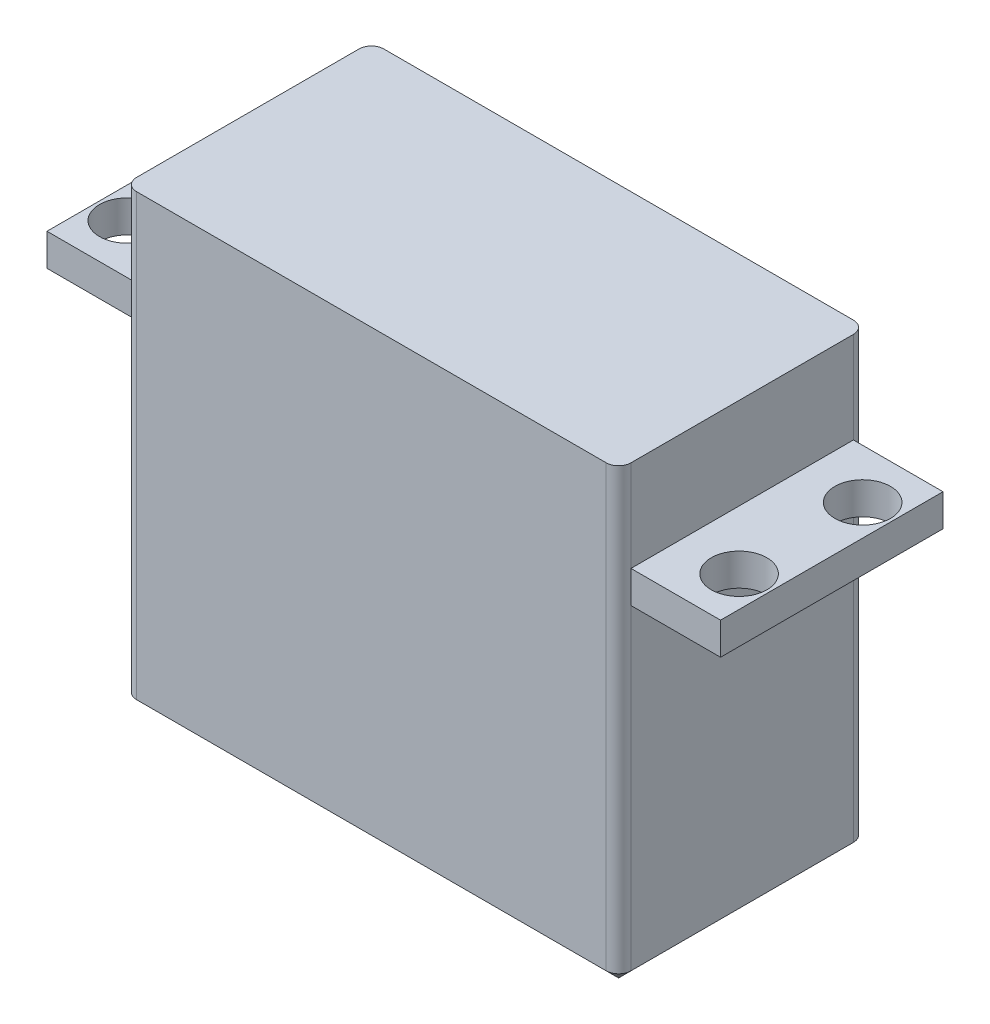
from build123d import *

# Parameters (mm, degrees)
SKETCH1_W               = 40
SKETCH1_H               = 20
BOSS_EXTRUDE1_DEPTH     = 36.6
SKETCH2_W               = 18
SKETCH2_H               = 2.6
BOSS_EXTRUDE2_DEPTH     = 7.25
SKETCH3_R               = 2.25
CUT_EXTRUDE1_DEPTH      = 42.17283692
MIRROR3_COPY_1_SKETCH_R = 2.25
MIRROR3_COPY_1_DEPTH    = 42.17283692
FILLET1_R               = 1
CHAMFER1_SIZE           = 1


with BuildPart() as part:
    # Sketch1 → Boss-Extrude1 (new body)
    with BuildSketch(Plane(origin=(0, 0, 0), x_dir=(1, 0, 0), z_dir=(0, 1, 0))):
        Rectangle(SKETCH1_W, SKETCH1_H)
    extrude(amount=BOSS_EXTRUDE1_DEPTH)

    # Sketch2 → Boss-Extrude2 (add)
    with BuildSketch(Plane(origin=(20, 0, 0), x_dir=(0, 0, -1), z_dir=(1, 0, 0))):
        with Locations((0, 27.9)):
            Rectangle(SKETCH2_W, SKETCH2_H)
    boss_extrude2 = extrude(amount=BOSS_EXTRUDE2_DEPTH)

    # Sketch3 → Cut-Extrude1 (cut, through all)
    with BuildSketch(Plane(origin=(0, 29.2, 0), x_dir=(1, 0, 0), z_dir=(0, 1, 0))):
        with Locations(Location((24.75, 5, 0), (0, 0, 270))):
            Circle(SKETCH3_R)
    cut_extrude1 = extrude(amount=-CUT_EXTRUDE1_DEPTH, mode=Mode.SUBTRACT)

    # Mirror2: Cut-Extrude1 across plane
    add(cut_extrude1.mirror(Plane.XY), mode=Mode.SUBTRACT)

    # Mirror3: Boss-Extrude2, Cut-Extrude1 across plane
    add(boss_extrude2.mirror(Plane(origin=(0, 0, 0), x_dir=(0, 0, 1), z_dir=(1, 0, 0))))
    add(cut_extrude1.mirror(Plane(origin=(0, 0, 0), x_dir=(0, 0, 1), z_dir=(1, 0, 0))), mode=Mode.SUBTRACT)

    # Mirror3 copy 1 sketch → Mirror3 copy 1 (cut, through all)
    with BuildSketch(Plane(origin=(0, 29.2, 0), x_dir=(-1, 0, 0), z_dir=(0, 1, 0))):
        with Locations(Location((24.75, 5, 0), (0, 0, 270))):
            Circle(MIRROR3_COPY_1_SKETCH_R)
    extrude(amount=-MIRROR3_COPY_1_DEPTH, mode=Mode.SUBTRACT)

    # Fillet1
    fillet1_edges = [part.edges().sort_by_distance(p)[0] for p in [
        (20, 18.3, 10),
        (-20, 18.3, 10),
        (-20, 18.3, -10),
        (20, 18.3, -10),
    ]]
    fillet(fillet1_edges, radius=FILLET1_R - 0.0001)  # a hair under: the kernel refuses the full size

    # Chamfer1
    chamfer1_edges = [part.edges().sort_by_distance(p)[0] for p in [
        (20, 0, 0),
        (0, 0, 10),
        (-20, 0, 0),
        (0, 0, -10),
        (-19.707136071, 0, 9.707136071),
        (-19.707136071, 0, -9.707136071),
        (19.707136071, 0, -9.707136071),
        (19.707136071, 0, 9.707136071),
    ]]
    chamfer(chamfer1_edges, length=CHAMFER1_SIZE - 0.0001)  # a hair under: the kernel refuses the full size


solid = part.part
